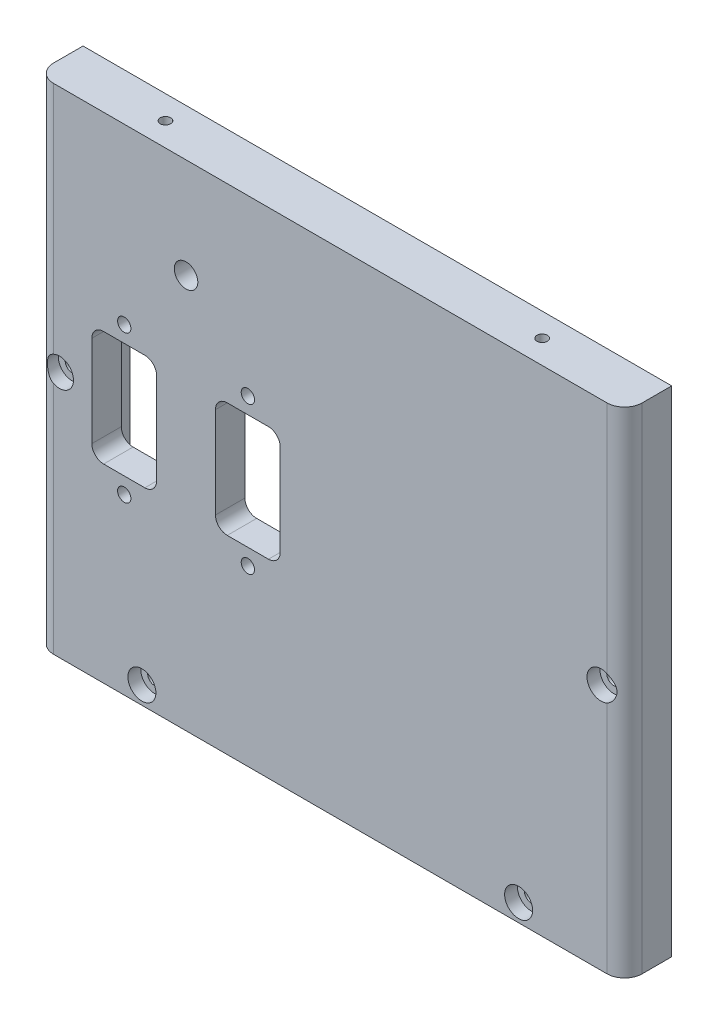
from build123d import *

# Parameters (mm, degrees)
SKETCH1_W                                      = 100
SKETCH1_H                                      = 84
BOSS_EXTRUDE1_DEPTH                            = 8
CBORE_FOR_2_SOCKET_HEAD_CAP_SCREW1_D           = 2.4384
CBORE_FOR_2_SOCKET_HEAD_CAP_SCREW1_DEPTH       = 12.27
CBORE_FOR_2_SOCKET_HEAD_CAP_SCREW1_CBORE_D     = 4.7625
CBORE_FOR_2_SOCKET_HEAD_CAP_SCREW1_CBORE_DEPTH = 2.1844
CBORE_FOR_2_SOCKET_HEAD_CAP_SCREW1_TIP         = 0.732569267
CBORE_FOR_2_SOCKET_HEAD_CAP_SCREW2_D           = 2.4384
CBORE_FOR_2_SOCKET_HEAD_CAP_SCREW2_DEPTH       = 12.27
CBORE_FOR_2_SOCKET_HEAD_CAP_SCREW2_CBORE_D     = 4.7625
CBORE_FOR_2_SOCKET_HEAD_CAP_SCREW2_CBORE_DEPTH = 2.1844
CBORE_FOR_2_SOCKET_HEAD_CAP_SCREW2_TIP         = 0.732569267
F_2_56_TAPPED_HOLE1_D                          = 1.778
F_2_56_TAPPED_HOLE1_DEPTH                      = 12
F_2_56_TAPPED_HOLE1_TIP                        = 0.53416509
SKETCH12_W                                     = 35
SKETCH12_H                                     = 60
CUT_EXTRUDE3_DEPTH                             = 3
FILLET1_R                                      = 2
FILLET2_R                                      = 2
FILLET3_R                                      = 2
FILLET4_R                                      = 2
SKETCH17_W                                     = 11
SKETCH17_H                                     = 19.5
CUT_EXTRUDE4_DEPTH                             = 8
SKETCH16_W                                     = 11
SKETCH16_H                                     = 19.5
CUT_EXTRUDE5_DEPTH                             = 8
FILLET5_R                                      = 2
FILLET6_R                                      = 2
FILLET7_R                                      = 2
FILLET8_R                                      = 2
F_4_40_TAPPED_HOLE1_D                          = 2.2606
SKETCH21_R                                     = 2
CUT_EXTRUDE6_DEPTH                             = 8
FILLET9_R                                      = 3


with BuildPart() as part:
    # Sketch1 → Boss-Extrude1 (new body)
    with BuildSketch(Plane.XY):
        Rectangle(SKETCH1_W, SKETCH1_H)
    extrude(amount=BOSS_EXTRUDE1_DEPTH)

    # CBORE for #2 Socket Head Cap Screw1
    with Locations(Plane(origin=(-32, -39, 8), x_dir=(1, 0, 0), z_dir=(0, 0, 1))):
        with Locations((0, 0), (64, 0)):
            CounterBoreHole(CBORE_FOR_2_SOCKET_HEAD_CAP_SCREW1_D / 2, CBORE_FOR_2_SOCKET_HEAD_CAP_SCREW1_CBORE_D / 2, CBORE_FOR_2_SOCKET_HEAD_CAP_SCREW1_CBORE_DEPTH, depth=CBORE_FOR_2_SOCKET_HEAD_CAP_SCREW1_DEPTH)
            with Locations((0, 0, -(CBORE_FOR_2_SOCKET_HEAD_CAP_SCREW1_DEPTH + CBORE_FOR_2_SOCKET_HEAD_CAP_SCREW1_TIP / 2))):  # 118° drill point
                Cone(0, CBORE_FOR_2_SOCKET_HEAD_CAP_SCREW1_D / 2, CBORE_FOR_2_SOCKET_HEAD_CAP_SCREW1_TIP, mode=Mode.SUBTRACT)

    # CBORE for #2 Socket Head Cap Screw2
    with Locations(Plane(origin=(-46, 0, 8), x_dir=(1, 0, 0), z_dir=(0, 0, 1))):
        with Locations((0, 0), (92, 0)):
            CounterBoreHole(CBORE_FOR_2_SOCKET_HEAD_CAP_SCREW2_D / 2, CBORE_FOR_2_SOCKET_HEAD_CAP_SCREW2_CBORE_D / 2, CBORE_FOR_2_SOCKET_HEAD_CAP_SCREW2_CBORE_DEPTH, depth=CBORE_FOR_2_SOCKET_HEAD_CAP_SCREW2_DEPTH)
            with Locations((0, 0, -(CBORE_FOR_2_SOCKET_HEAD_CAP_SCREW2_DEPTH + CBORE_FOR_2_SOCKET_HEAD_CAP_SCREW2_TIP / 2))):  # 118° drill point
                Cone(0, CBORE_FOR_2_SOCKET_HEAD_CAP_SCREW2_D / 2, CBORE_FOR_2_SOCKET_HEAD_CAP_SCREW2_TIP, mode=Mode.SUBTRACT)

    # #2-56 Tapped Hole1
    with Locations(Plane(origin=(-32, 42, 4), x_dir=(0, 0, 1), z_dir=(0, 1, 0))):
        with Locations((0, 0), (0, 64)):
            Hole(F_2_56_TAPPED_HOLE1_D / 2, depth=F_2_56_TAPPED_HOLE1_DEPTH)
            with Locations((0, 0, -(F_2_56_TAPPED_HOLE1_DEPTH + F_2_56_TAPPED_HOLE1_TIP / 2))):  # 118° drill point
                Cone(0, F_2_56_TAPPED_HOLE1_D / 2, F_2_56_TAPPED_HOLE1_TIP, mode=Mode.SUBTRACT)

    # Sketch12 → Cut-Extrude3 (cut)
    with BuildSketch(Plane(origin=(0, 0, 0), x_dir=(-1, 0, 0), z_dir=(0, 0, -1))):
        with Locations((24.5, 0)):
            Rectangle(SKETCH12_W, SKETCH12_H)
    extrude(amount=-CUT_EXTRUDE3_DEPTH, mode=Mode.SUBTRACT)

    # Fillet1
    fillet1_edges = [part.edges().sort_by_distance(p)[0] for p in [
        (-7, 30, 1.5),
    ]]
    fillet(fillet1_edges, radius=FILLET1_R)

    # Fillet2
    fillet2_edges = [part.edges().sort_by_distance(p)[0] for p in [
        (-42, 30, 1.5),
    ]]
    fillet(fillet2_edges, radius=FILLET2_R)

    # Fillet3
    fillet3_edges = [part.edges().sort_by_distance(p)[0] for p in [
        (-42, -30, 1.5),
    ]]
    fillet(fillet3_edges, radius=FILLET3_R)

    # Fillet4
    fillet4_edges = [part.edges().sort_by_distance(p)[0] for p in [
        (-7, -30, 1.5),
    ]]
    fillet(fillet4_edges, radius=FILLET4_R)

    # Sketch17 → Cut-Extrude4 (cut)
    with BuildSketch(Plane(origin=(0, 0, 3), x_dir=(-1, 0, 0), z_dir=(0, 0, -1))):
        with Locations((35, 0)):
            Rectangle(SKETCH17_W, SKETCH17_H)
    extrude(amount=-CUT_EXTRUDE4_DEPTH, mode=Mode.SUBTRACT)

    # Sketch16 → Cut-Extrude5 (cut)
    with BuildSketch(Plane(origin=(0, 0, 3), x_dir=(-1, 0, 0), z_dir=(0, 0, -1))):
        with Locations((14, 0)):
            Rectangle(SKETCH16_W, SKETCH16_H)
    extrude(amount=-CUT_EXTRUDE5_DEPTH, mode=Mode.SUBTRACT)

    # Fillet5
    fillet5_edges = [part.edges().sort_by_distance(p)[0] for p in [
        (-40.5, 9.75, 5.5),
        (-19.5, 9.75, 5.5),
    ]]
    fillet(fillet5_edges, radius=FILLET5_R)

    # Fillet6
    fillet6_edges = [part.edges().sort_by_distance(p)[0] for p in [
        (-29.5, 9.75, 5.5),
        (-8.5, 9.75, 5.5),
    ]]
    fillet(fillet6_edges, radius=FILLET6_R)

    # Fillet7
    fillet7_edges = [part.edges().sort_by_distance(p)[0] for p in [
        (-29.5, -9.75, 5.5),
        (-8.5, -9.75, 5.5),
    ]]
    fillet(fillet7_edges, radius=FILLET7_R)

    # Fillet8
    fillet8_edges = [part.edges().sort_by_distance(p)[0] for p in [
        (-40.5, -9.75, 5.5),
        (-19.5, -9.75, 5.5),
    ]]
    fillet(fillet8_edges, radius=FILLET8_R)

    # #4-40 Tapped Hole1 (through all)
    with Locations(Plane(origin=(-35, 12.5, 8), x_dir=(1, 0, 0), z_dir=(0, 0, 1))):
        with Locations((0, 0), (0, -25), (21, -25), (21, 0)):
            Hole(F_4_40_TAPPED_HOLE1_D / 2)

    # Sketch21 → Cut-Extrude6 (cut)
    with BuildSketch(Plane(origin=(0, 0, 3), x_dir=(-1, 0, 0), z_dir=(0, 0, -1))):
        with Locations((24.5, 25)):
            Circle(SKETCH21_R)
    extrude(amount=-CUT_EXTRUDE6_DEPTH, mode=Mode.SUBTRACT)

    # Fillet9
    # the kernel refuses this fillet: 3 mm, written as the material it takes off along each edge
    with BuildSketch(Plane(origin=(-50, -49.5, 8), x_dir=(1, 0, 0), z_dir=(0, 1, 0)), Plane(origin=(50, 49.5, 8), x_dir=(-1, 0, 0), z_dir=(0, -1, 0))) as fillet9_piece_1:
        with BuildLine():
            CenterArc((FILLET9_R, FILLET9_R), FILLET9_R, 180, 90)
            Line((0, FILLET9_R), (0, 0))
            Line((0, 0), (FILLET9_R, 0))
        make_face()
    extrude(amount=99, mode=Mode.SUBTRACT)


solid = part.part
